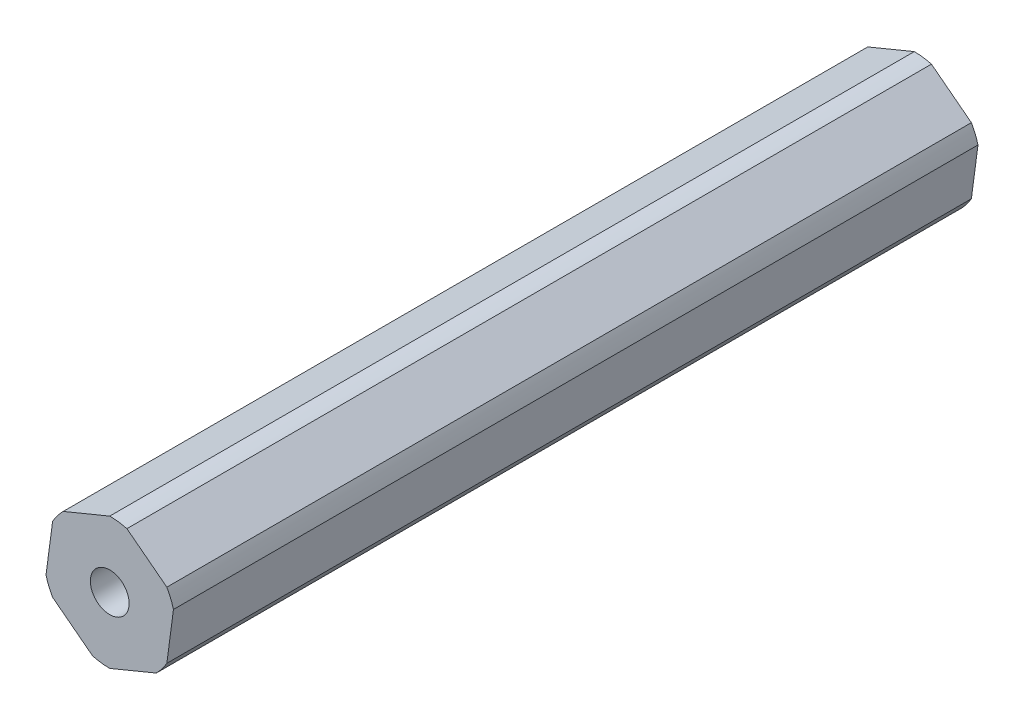
from build123d import *

# Parameters (mm, degrees)
BOSS_EXTRUDE1_DEPTH        = 83.82
F_10_32_TAPPED_HOLE1_D     = 4.0386
F_10_32_TAPPED_HOLE1_DEPTH = 12.0396
F_10_32_TAPPED_HOLE1_TIP   = 1.213317848
F_10_32_TAPPED_HOLE2_D     = 4.0386
F_10_32_TAPPED_HOLE2_DEPTH = 12.0396
F_10_32_TAPPED_HOLE2_TIP   = 1.213317848


with BuildPart() as part:
    # Sketch1 → Boss-Extrude1 (new body)
    with BuildSketch(Plane.XY):
        with BuildLine():
            Line((5.950200742, 3.43535), (1.789892893, 6.63346078))
            ThreePointArc((1.789892893, 6.63346078), (0.902773368, 6.811131972), (0, 6.8707))
            Line((0, 6.8707), (-4.849799104, 4.866823105))
            ThreePointArc((-4.849799104, 4.866823105), (-5.447226632, 4.187390656), (-5.950200742, 3.43535))
            Line((-5.950200742, 3.43535), (-6.639691997, -1.766637675))
            ThreePointArc((-6.639691997, -1.766637675), (-6.35, -2.623741315), (-5.950200742, -3.43535))
            Line((-5.950200742, -3.43535), (-1.789892893, -6.63346078))
            ThreePointArc((-1.789892893, -6.63346078), (-0.902773368, -6.811131972), (0, -6.8707))
            Line((0, -6.8707), (4.849799104, -4.866823105))
            ThreePointArc((4.849799104, -4.866823105), (5.447226632, -4.187390656), (5.950200742, -3.43535))
            Line((5.950200742, -3.43535), (6.639691997, 1.766637675))
            ThreePointArc((6.639691997, 1.766637675), (6.35, 2.623741315), (5.950200742, 3.43535))
        make_face()
    extrude(amount=BOSS_EXTRUDE1_DEPTH)

    # #10-32 Tapped Hole1
    with Locations(Plane.XY.offset(83.82)):
        with Locations((0, 0)):
            Hole(F_10_32_TAPPED_HOLE1_D / 2, depth=F_10_32_TAPPED_HOLE1_DEPTH)
            with Locations((0, 0, -(F_10_32_TAPPED_HOLE1_DEPTH + F_10_32_TAPPED_HOLE1_TIP / 2))):  # 118° drill point
                Cone(0, F_10_32_TAPPED_HOLE1_D / 2, F_10_32_TAPPED_HOLE1_TIP, mode=Mode.SUBTRACT)

    # #10-32 Tapped Hole2
    with Locations(Plane(origin=(0, 0, 0), x_dir=(-1, 0, 0), z_dir=(0, 0, -1))):
        with Locations((0, 0)):
            Hole(F_10_32_TAPPED_HOLE2_D / 2, depth=F_10_32_TAPPED_HOLE2_DEPTH)
            with Locations((0, 0, -(F_10_32_TAPPED_HOLE2_DEPTH + F_10_32_TAPPED_HOLE2_TIP / 2))):  # 118° drill point
                Cone(0, F_10_32_TAPPED_HOLE2_D / 2, F_10_32_TAPPED_HOLE2_TIP, mode=Mode.SUBTRACT)


solid = part.part
